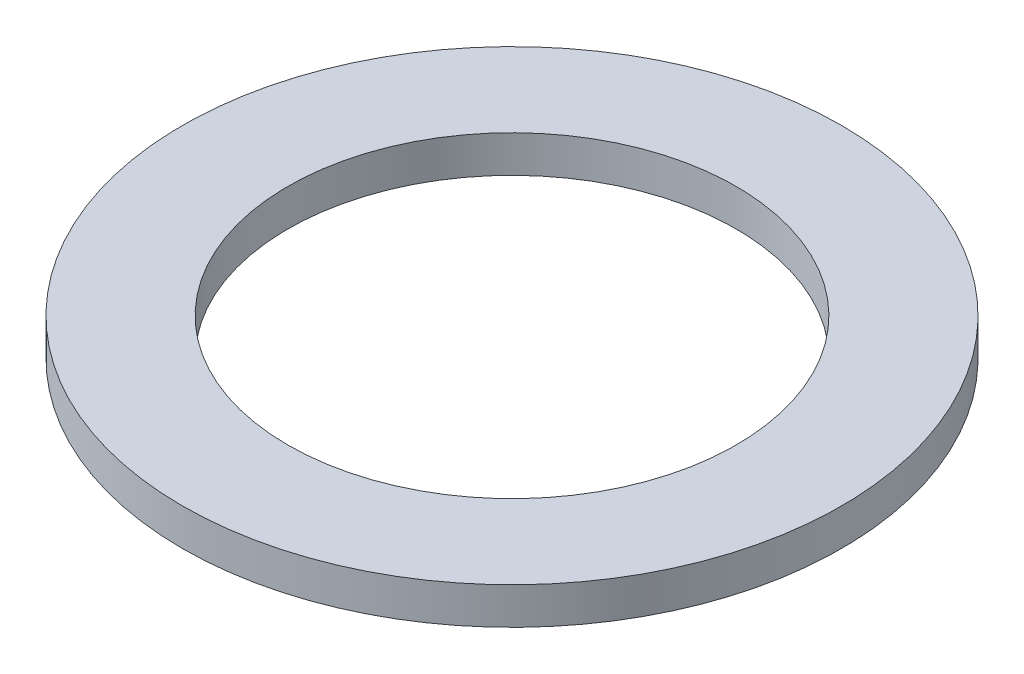
from build123d import *

# Parameters (mm, degrees)
SKETCH1_R           = 62.5
BOSS_EXTRUDE1_DEPTH = 7
SKETCH2_R           = 42.5
CUT_EXTRUDE1_DEPTH  = 89.665100237


with BuildPart() as part:
    # Sketch1 → Boss-Extrude1 (new body)
    with BuildSketch(Plane(origin=(0, 0, 0), x_dir=(1, 0, 0), z_dir=(0, 1, 0))):
        Circle(SKETCH1_R)
    extrude(amount=BOSS_EXTRUDE1_DEPTH)

    # Sketch2 → Cut-Extrude1 (cut, through all)
    with BuildSketch(Plane(origin=(0, 0, 0), x_dir=(1, 0, 0), z_dir=(0, 1, 0))):
        Circle(SKETCH2_R)
    extrude(amount=CUT_EXTRUDE1_DEPTH, mode=Mode.SUBTRACT)


solid = part.part
